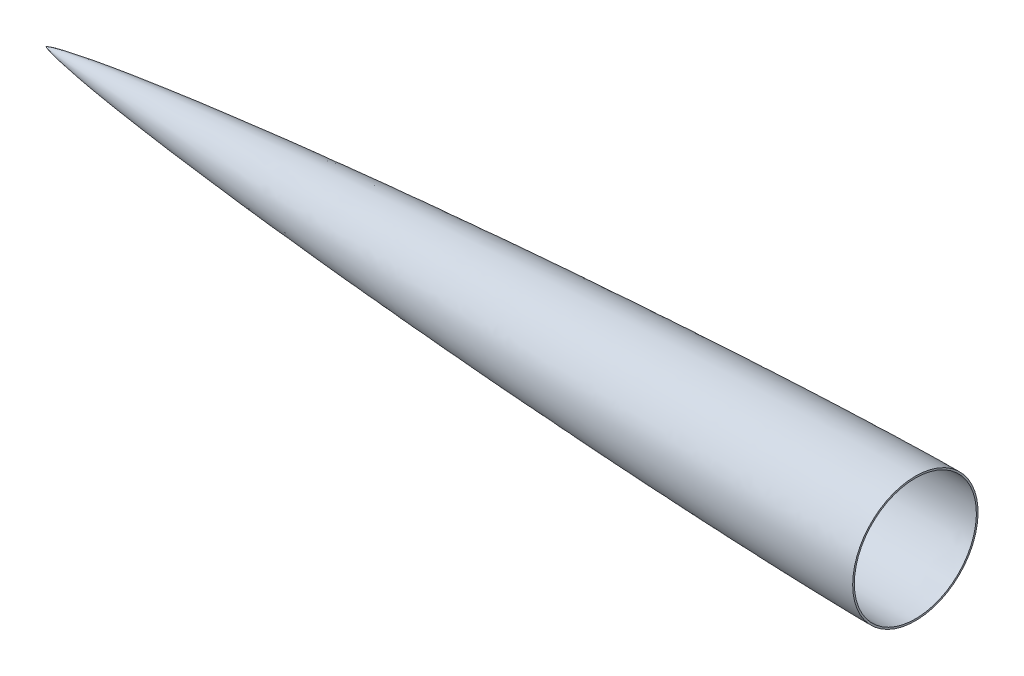
from build123d import *


with BuildPart() as part:
    # Sketch2 → Revolve1 (revolve)
    with BuildSketch(Plane.XY):
        with BuildLine():
            Line((0, 0), (6.083087354, 0))
            add(Edge.make_bspline(
                [(6.083087354, 0), (8.666554215, 0.671479654), (13.867147893, 1.820093912), (24.44051308, 3.866402531), (37.726189303, 6.097779385), (53.734671408, 8.516614166), (75.12116558, 11.500751977), (101.911109841, 14.899706888), (134.10597298, 18.638381866), (166.334469439, 22.118866873), (209.337194896, 26.48753774), (263.136993616, 31.5222572), (327.746259792, 37.045146675), (392.393231639, 42.133467491), (457.070245093, 46.840867515), (543.339917099, 52.651475734), (651.231199191, 59.092413855), (759.180402396, 64.46621726), (845.569781324, 68.051326251), (910.375115105, 70.335764039), (964.391031339, 71.834459954), (1002.202137231, 72.58791977), (1023.811193315, 72.888758577), (1034.605095766, 72.990292925), (1040.003597404, 73.000003235)],
                knots=[0.00568619, 0.00568619, 0.00568619, 0.00568619, 0.013454266, 0.021222343, 0.036758496, 0.05229465, 0.067830803, 0.09890311, 0.129975416, 0.161047723, 0.192120029, 0.254264642, 0.316409255, 0.378553869, 0.440698482, 0.502843095, 0.627132321, 0.751421547, 0.813566161, 0.875710774, 0.937855387, 0.968927693, 0.984463847, 1, 1, 1, 1], degree=3))
            Line((1040.003597404, 73.000003235), (1040, 75))
            add(Edge.make_bspline(
                [(0, 0), (0.002212249, 0.004729711), (0.007268177, 0.013740488), (0.020147656, 0.029829796), (0.050507121, 0.057992991), (0.095227496, 0.092808318), (0.155283275, 0.13295844), (0.243574522, 0.186146878), (0.352306221, 0.245204469), (0.513451522, 0.325434288), (0.728839807, 0.422713), (0.981216509, 0.527713634), (1.270652268, 0.639778226), (1.587964462, 0.755892861), (1.933150481, 0.875786302), (2.499867445, 1.063587308), (3.515163347, 1.376769334), (5.368011716, 1.895966187), (8.862383095, 2.765179534), (15.347181017, 4.17800304), (27.630494937, 6.492235966), (49.738285718, 10.055840863), (85.900623212, 15.041563658), (134.6079854, 20.831639815), (192.823550537, 26.943808104), (256.109971039, 32.918005485), (319.442063046, 38.382816602), (382.809237918, 43.42313038), (446.204756809, 48.09206811), (509.624306071, 52.421908519), (573.064820229, 56.432373575), (636.524172477, 60.132761418), (700.000804791, 63.523898331), (763.493631739, 66.597410723), (827.001909818, 69.334201922), (882.584800883, 71.403383086), (930.236586287, 72.905232102), (968.7777642, 73.905143219), (994.819630237, 74.455007048), (1016.303909692, 74.802126478), (1029.844287429, 74.94754495), (1036.614721103, 74.993910883), (1040, 75)],
                knots=[0, 0, 0, 0, 0, 1.9752e-05, 3.9503e-05, 7.9006e-05, 0.000158012, 0.000237019, 0.000316025, 0.000474037, 0.000632049, 0.000926824, 0.001221599, 0.001521544, 0.001821489, 0.002221761, 0.002622034, 0.003809607, 0.005893267, 0.009595513, 0.016420779, 0.029242914, 0.053792858, 0.095411026, 0.156317553, 0.217224079, 0.278130606, 0.339037133, 0.39994366, 0.460850187, 0.521756713, 0.58266324, 0.643569767, 0.704476295, 0.765382822, 0.826289349, 0.887195876, 0.917649139, 0.948102403, 0.974051201, 0.987025601, 1, 1, 1, 1, 1], degree=4))
        make_face()
    revolve(axis=Axis((0, 0, 0), (1, 0, 0)))


solid = part.part
